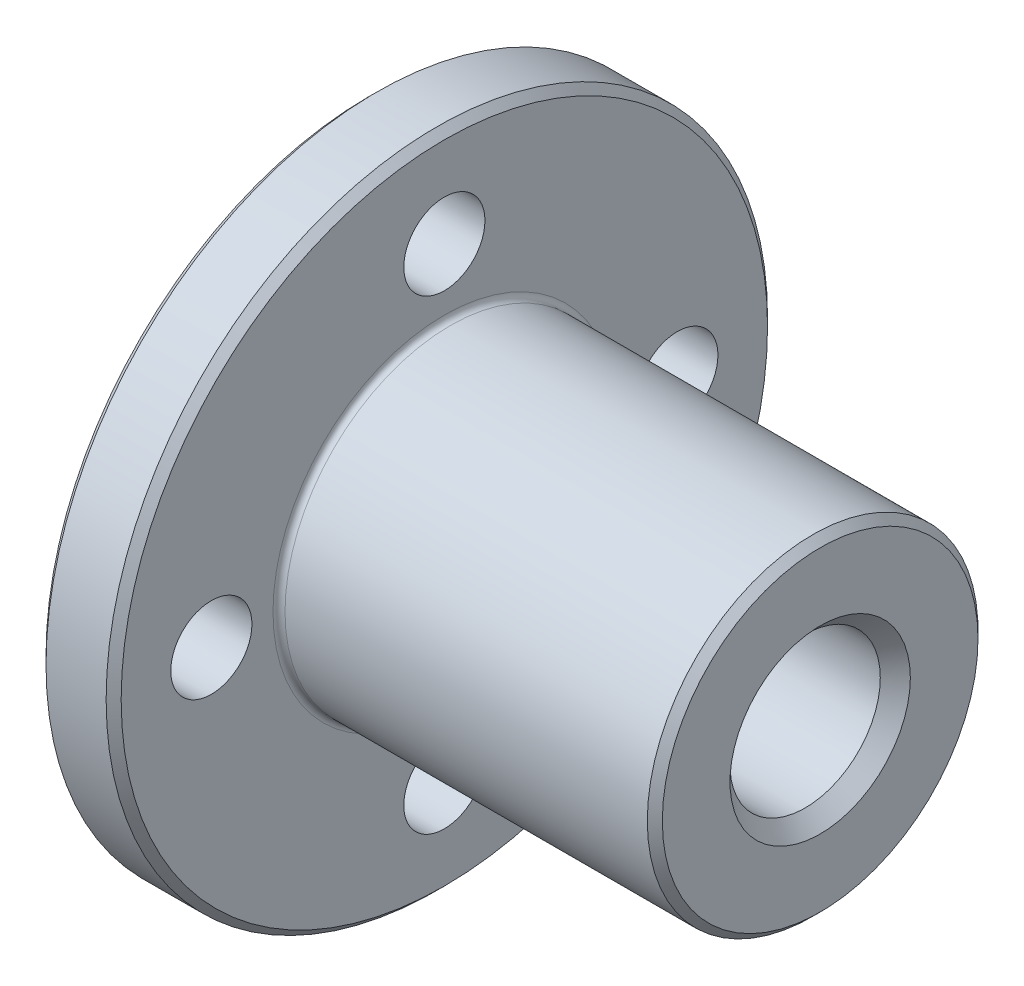
from build123d import *

# Parameters (mm, degrees)
SKETCH1_W      = 5
SKETCH1_H      = 22
SKETCH2_R      = 11
EXTRUDE1_DEPTH = 25
HOLEWZD1_D     = 5.4
HOLEWZD2_D     = 10
CHAMFER1_SIZE  = 0.5
CHAMFER2_SIZE  = 1
FILLET1_R      = 0.4


with BuildPart() as part:
    # Sketch1 → Revolve1 (revolve)
    with BuildSketch(Plane(origin=(0, 0, 0), x_dir=(-1, 0, 0), z_dir=(0, 0, -1))):
        with Locations((-2.5, 11)):
            Rectangle(SKETCH1_W, SKETCH1_H)
    revolve(axis=Axis((5, 0, 0), (-1, 0, 0)))

    # Sketch2 → Extrude1 (add)
    with BuildSketch(Plane(origin=(5, 0, 0), x_dir=(0, 0, -1), z_dir=(1, 0, 0))):
        Circle(SKETCH2_R)
    extrude(amount=EXTRUDE1_DEPTH)

    # HoleWzd1 (through all)
    with Locations(Plane(origin=(5, 0, 0), x_dir=(0, 0, -1), z_dir=(1, 0, 0))):
        with Locations((0, -15.5), (15.5, 0), (-15.5, 0), (0, 15.5)):
            Hole(HOLEWZD1_D / 2)

    # HoleWzd2 (through all)
    with Locations(Plane(origin=(30, 0, 0), x_dir=(0, 0, -1), z_dir=(1, 0, 0))):
        with Locations((0, 0)):
            Hole(HOLEWZD2_D / 2)

    # Chamfer1
    chamfer1_edges = [part.edges().sort_by_distance(p)[0] for p in [
        (0, -22, 0),
        (30, 0, 11),
        (5, -22, 0),
    ]]
    chamfer(chamfer1_edges, length=CHAMFER1_SIZE)

    # Chamfer2
    chamfer2_edges = [part.edges().sort_by_distance(p)[0] for p in [
        (0, 0, -5),
        (30, 0, -5),
    ]]
    chamfer(chamfer2_edges, length=CHAMFER2_SIZE)

    # Fillet1
    fillet1_edges = [part.edges().sort_by_distance(p)[0] for p in [
        (5, 0, 11),
    ]]
    fillet(fillet1_edges, radius=FILLET1_R)


solid = part.part
